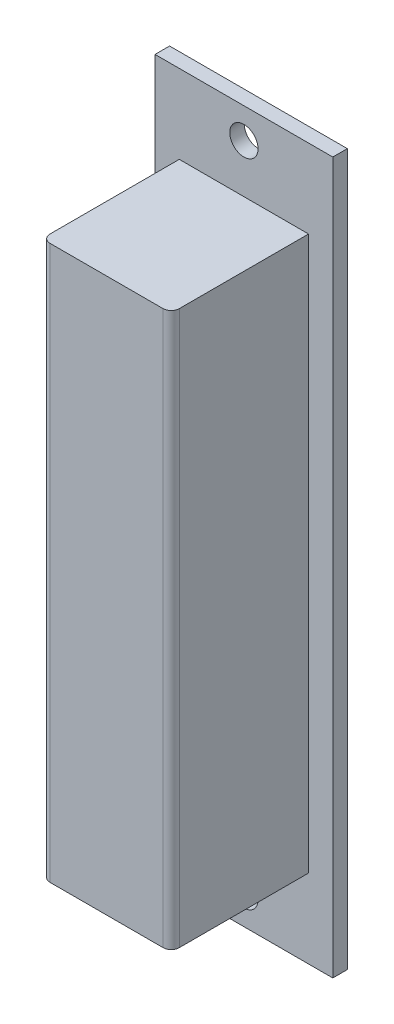
from build123d import *

# Parameters (mm, degrees)
SKETCH_1_W      = 22
SKETCH_1_H      = 88
SKETCH_1_R      = 1.75
EXTRUDE_1_DEPTH = 1.8
SKETCH_2_W      = 16
SKETCH_2_H      = 68.5
EXTRUDE_2_DEPTH = 17
FILLET_1_R      = 1


with BuildPart() as part:
    # 草图1 → 拉伸1 (new body)
    with BuildSketch(Plane.XY):
        Rectangle(SKETCH_1_W, SKETCH_1_H)
        with Locations((0, 40.25)):
            Circle(SKETCH_1_R, mode=Mode.SUBTRACT)
        with Locations((0, -40.25)):
            Circle(SKETCH_1_R, mode=Mode.SUBTRACT)
    extrude(amount=EXTRUDE_1_DEPTH)

    # 草图2 → 拉伸2 (add)
    with BuildSketch(Plane.XY.offset(1.8)):
        Rectangle(SKETCH_2_W, SKETCH_2_H)
    extrude(amount=EXTRUDE_2_DEPTH)

    # 圆角1
    fillet_1_edges = [part.edges().sort_by_distance(p)[0] for p in [
        (-8, 0, 18.8),
        (8, 0, 18.8),
    ]]
    fillet(fillet_1_edges, radius=FILLET_1_R)


solid = part.part
